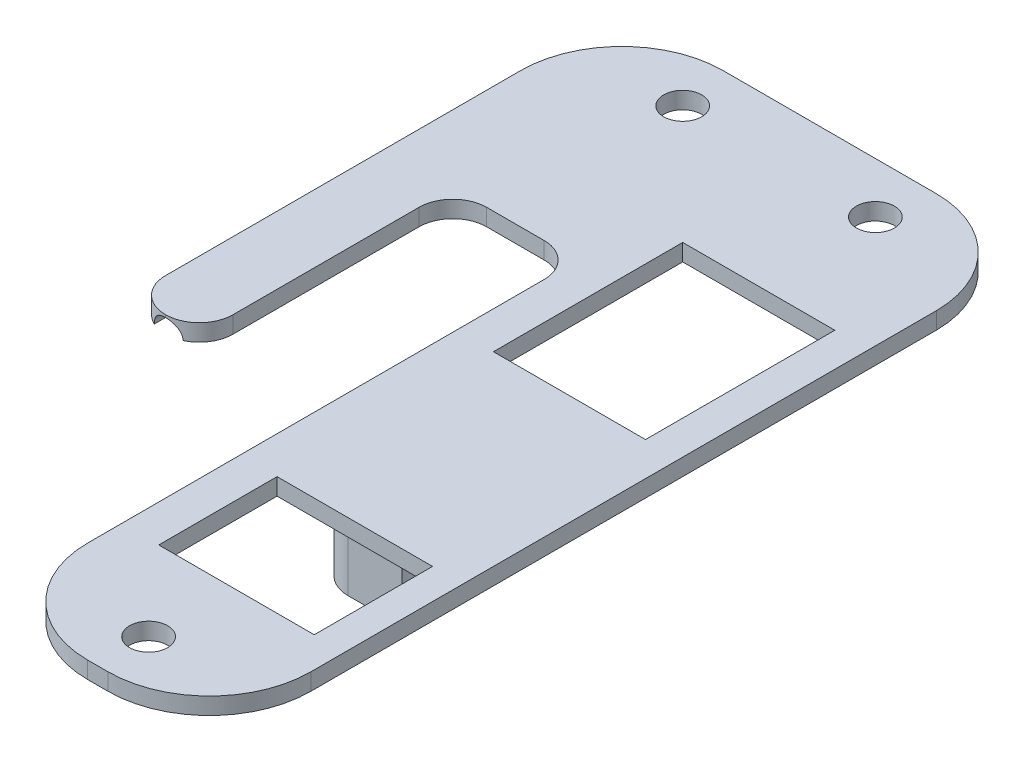
from build123d import *

# Parameters (mm, degrees)
BOSS_EXTRUDE1_DEPTH = 1
SKETCH4_R           = 1.125
CUT_EXTRUDE3_DEPTH  = 6
FILLET1_R           = 6
FILLET2_R           = 2
SKETCH3_R           = 0.85
CUT_EXTRUDE5_DEPTH  = 20
SKETCH6_W           = 11
SKETCH6_H           = 7
CUT_EXTRUDE6_DEPTH  = 0.7
SKETCH7_W           = 9.2
SKETCH7_H           = 7
SKETCH7_W_2         = 9
SKETCH7_H_2         = 11.2
CUT_EXTRUDE7_DEPTH  = 30.733515978
SKETCH8_W           = 5.2
SKETCH8_H           = 10
BOSS_EXTRUDE2_DEPTH = 5
FILLET4_R           = 2


with BuildPart() as part:
    # Sketch1 → Boss-Extrude1 (new body)
    with BuildSketch(Plane(origin=(0, 0, 0), x_dir=(1, 0, 0), z_dir=(0, 1, 0))):
        Polygon((-16.635707691, 24.623874564), (7.964292309, 24.623874564), (7.964292309, -24.376125436), (-5.235707691, -24.376125436), (-5.235707691, 10.623874564), (-12.635707691, 10.623874564), (-12.635707691, -4.376125436), (-16.635707691, -4.376125436), align=None)
    extrude(amount=BOSS_EXTRUDE1_DEPTH)

    # Sketch4 → Cut-Extrude3 (cut)
    with BuildSketch(Plane(origin=(0, 1, 0), x_dir=(1, 0, 0), z_dir=(0, 1, 0))):
        with Locations(Location((-10.035707691, 21.623874564, 0), (0, 0, 270))):
            Circle(SKETCH4_R)
        with Locations(Location((1.364292309, 21.623874564, 0), (0, 0, 270))):
            Circle(SKETCH4_R)
        with Locations(Location((1.364292309, -21.376125436, 0), (0, 0, 270))):
            Circle(SKETCH4_R)
    extrude(amount=-CUT_EXTRUDE3_DEPTH, mode=Mode.SUBTRACT)

    # Fillet1
    fillet1_edges = [part.edges().sort_by_distance(p)[0] for p in [
        (-16.635707691, 0.5, -24.623874564),
        (7.964292309, 0.5, -24.623874564),
        (7.964292309, 0.5, 24.376125436),
        (-5.235707691, 0.5, 24.376125436),
    ]]
    fillet(fillet1_edges, radius=FILLET1_R)

    # Fillet2
    fillet2_edges = [part.edges().sort_by_distance(p)[0] for p in [
        (-5.235707691, 0.5, -10.623874564),
        (-12.635707691, 0.5, -10.623874564),
    ]]
    fillet(fillet2_edges, radius=FILLET2_R)
    fillet2_2_edges = [part.edges().sort_by_distance(p)[0] for p in [
        (-12.635707691, 0.5, 4.376125436),
        (-16.635707691, 0.5, 4.376125436),
    ]]
    fillet(fillet2_2_edges, radius=FILLET2_R - 0.0001)  # a hair under: the kernel refuses the full size

    # Sketch3 → Cut-Extrude5 (cut)
    with BuildSketch(Plane.XY.offset(4.376125436)):
        with Locations((-14.635707691, 0)):
            Circle(SKETCH3_R)
    extrude(amount=-CUT_EXTRUDE5_DEPTH, mode=Mode.SUBTRACT)

    # Sketch6 → Cut-Extrude6 (cut)
    with BuildSketch(Plane.XZ):
        with Locations((-9.985707691, -15.123874564)):
            Rectangle(SKETCH6_W, SKETCH6_H)
    extrude(amount=-CUT_EXTRUDE6_DEPTH, mode=Mode.SUBTRACT)

    # Sketch7 → Cut-Extrude7 (cut, through all)
    with BuildSketch(Plane(origin=(0, 1, 0), x_dir=(1, 0, 0), z_dir=(0, 1, 0))):
        with Locations((1.564292309, -12.876125436)):
            Rectangle(SKETCH7_W, SKETCH7_H)
        with Locations((1.464292309, 9.023874564)):
            Rectangle(SKETCH7_W_2, SKETCH7_H_2)
    extrude(amount=-CUT_EXTRUDE7_DEPTH, mode=Mode.SUBTRACT)

    # Sketch8 → Boss-Extrude2 (add)
    with BuildSketch(Plane.XZ):
        with Locations((-0.235707691, 2.376125436)):
            Rectangle(SKETCH8_W, SKETCH8_H)
    extrude(amount=BOSS_EXTRUDE2_DEPTH)

    # Fillet4
    fillet4_edges = [part.edges().sort_by_distance(p)[0] for p in [
        (-2.835707691, -2.5, 7.376125436),
        (-2.835707691, -2.5, -2.623874564),
    ]]
    fillet(fillet4_edges, radius=FILLET4_R)


solid = part.part
